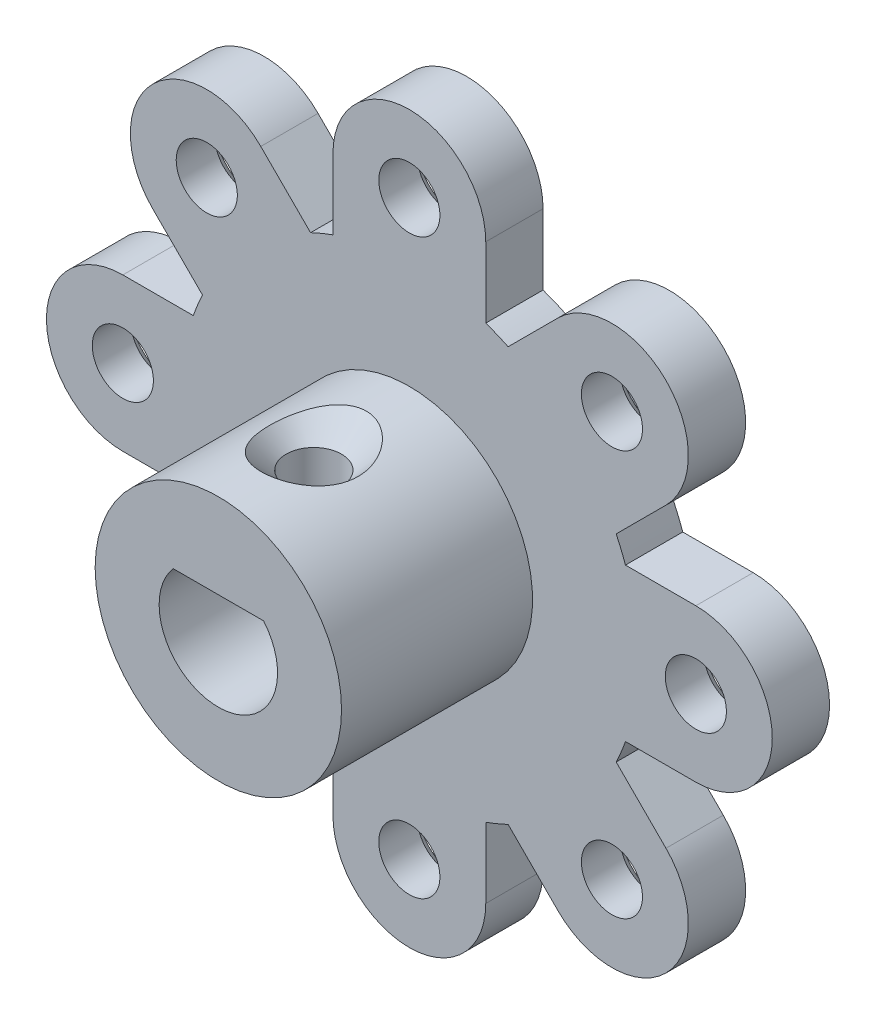
from build123d import *
from build123d.topology import SkipClean

# Parameters (mm, degrees)
MAIN_DEPTH                                        = 3
R_P_TITION_CIRCULAIRE1_COUNT                      = 8
ESQUISSE2_R                                       = 6.45
ESQUISSE2_R_2                                     = 3.1
MOTORLINK_DEPTH                                   = 10
MEPLAT_DEPTH                                      = 10
ESQUISSE4_R                                       = 3.1
HOLE_DEPTH                                        = 29.670542374
ESQUISSE5_R                                       = 4
ESQUISSE5_R_2                                     = 3.1
ROLLINGBEARINGLINK_DEPTH                          = 7
ESQUISSE6_R                                       = 5
ESQUISSE6_R_2                                     = 4
ROLLINGBEARLINK2_DEPTH                            = 0.5
FRAISAGE_POUR_VIS_T_TE_FRAIS_E_100_D              = 3.2
FRAISAGE_POUR_VIS_T_TE_FRAIS_E_100_CSINK_D        = 5.5
FRAISAGE_POUR_VIS_T_TE_FRAIS_E_100_CSINK_ANGLE    = 100
R_P_TITION_CIRCULAIRE2_COUNT                      = 8
CSK_FOR_M2_5_FLAT_HEAD_MACHINE_SCREW1_D           = 2.9
CSK_FOR_M2_5_FLAT_HEAD_MACHINE_SCREW1_CSINK_D     = 5.5
CSK_FOR_M2_5_FLAT_HEAD_MACHINE_SCREW1_CSINK_ANGLE = 90


with BuildPart() as part:
    # Esquisse1 → Main (new body)
    with BuildSketch(Plane.XY):
        with BuildLine():
            Line((11.313708499, 4), (15, 4))
            ThreePointArc((15, 4), (19, 0), (15, -4))
            Line((15, -4), (11.313708499, -4))
            ThreePointArc((11.313708499, -4), (11.204044803, -4.297601664), (11.08655439, -4.592201188))
            Line((11.08655439, -4.592201188), (0, 0))
            Line((0, 0), (11.08655439, 4.592201188))
            ThreePointArc((11.08655439, 4.592201188), (11.204044803, 4.297601664), (11.313708499, 4))
        make_face()
    main = extrude(amount=MAIN_DEPTH)

    # Répétition circulaire1: Main ×8 about axis
    r_p_tition_circulaire1_axis = Axis((0, 0, 11.883707709), (0, 0, -1))
    for i in range(1, R_P_TITION_CIRCULAIRE1_COUNT):
        add(main.rotate(r_p_tition_circulaire1_axis, i * 360 / R_P_TITION_CIRCULAIRE1_COUNT))

    # Esquisse2 → MotorLink (add)
    with BuildSketch(Plane.XY.offset(3)):
        Circle(ESQUISSE2_R)
        Circle(ESQUISSE2_R_2, mode=Mode.SUBTRACT)
    extrude(amount=MOTORLINK_DEPTH)

    # Esquisse3 → Meplat (add)
    with BuildSketch(Plane.XY.offset(3)):
        with BuildLine():
            Line((-2.368543856, 2), (2.368543856, 2))
            ThreePointArc((2.368543856, 2), (0, 3.1), (-2.368543856, 2))
        make_face()
    extrude(amount=MEPLAT_DEPTH)

    # Esquisse4 → Hole (cut, through all)
    with SkipClean():  # the faces are left unmerged after this step: merging them gives an invalid solid
        with BuildSketch(Plane.XY.offset(3)):
            Circle(ESQUISSE4_R)
        extrude(amount=-HOLE_DEPTH, mode=Mode.SUBTRACT)

    # Esquisse5 → RollingBearingLink (add)
    with SkipClean():  # the faces are left unmerged after this step: merging them gives an invalid solid
        with BuildSketch(Plane(origin=(0, 0, 0), x_dir=(-1, 0, 0), z_dir=(0, 0, -1))):
            Circle(ESQUISSE5_R)
            Circle(ESQUISSE5_R_2, mode=Mode.SUBTRACT)
        extrude(amount=ROLLINGBEARINGLINK_DEPTH)

    # Esquisse6 → RollingBearLink2 (add)
    with SkipClean():  # the faces are left unmerged after this step: merging them gives an invalid solid
        with BuildSketch(Plane(origin=(0, 0, 0), x_dir=(-1, 0, 0), z_dir=(0, 0, -1))):
            Circle(ESQUISSE6_R)
            Circle(ESQUISSE6_R_2, mode=Mode.SUBTRACT)
        extrude(amount=ROLLINGBEARLINK2_DEPTH)
    add(part.part.scale(1), mode=Mode.REPLACE)  # the faces are merged on a copy

    # Fraisage pour vis à tête fraisée (100) #01 (through all)
    with Locations(Plane(origin=(0, 0, 0), x_dir=(-1, 0, 0), z_dir=(0, 0, -1))):
        with Locations((15, 0)):
            fraisage_pour_vis_t_te_frais_e_100 = CounterSinkHole(FRAISAGE_POUR_VIS_T_TE_FRAIS_E_100_D / 2, FRAISAGE_POUR_VIS_T_TE_FRAIS_E_100_CSINK_D / 2, counter_sink_angle=FRAISAGE_POUR_VIS_T_TE_FRAIS_E_100_CSINK_ANGLE)

    # Répétition circulaire2: Fraisage pour vis à tête fraisée (100) #01 ×8 about axis
    r_p_tition_circulaire2_axis = Axis((0, 0, 11.883707709), (0, 0, -1))
    for i in range(1, R_P_TITION_CIRCULAIRE2_COUNT):
        add(fraisage_pour_vis_t_te_frais_e_100.rotate(r_p_tition_circulaire2_axis, i * 360 / R_P_TITION_CIRCULAIRE2_COUNT), mode=Mode.SUBTRACT)

    # CSK for M2.5 Flat Head Machine Screw1 (through all)
    with Locations(Plane(origin=(0, 6.45, 0), x_dir=(1, 0, 0), z_dir=(0, 1, 0))):
        with Locations((0, -8)):
            CounterSinkHole(CSK_FOR_M2_5_FLAT_HEAD_MACHINE_SCREW1_D / 2, CSK_FOR_M2_5_FLAT_HEAD_MACHINE_SCREW1_CSINK_D / 2, counter_sink_angle=CSK_FOR_M2_5_FLAT_HEAD_MACHINE_SCREW1_CSINK_ANGLE)


solid = part.part
